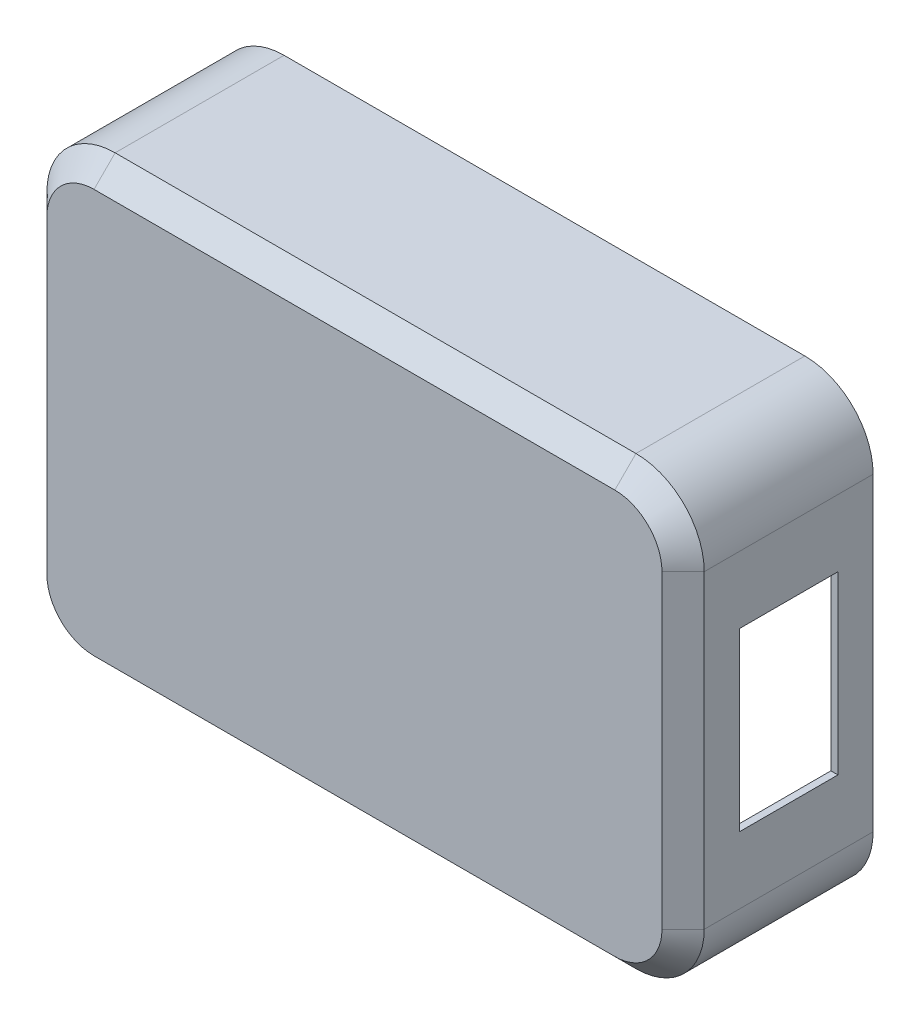
from build123d import *

# Parameters (mm, degrees)
BOSS_EXTRUDE1_DEPTH     = 27
CHAMFER1_SIZE           = 3
SHELL1_T                = -1
CUT_EXTRUDE1_REACH      = 131.009
SKETCH2_W               = 14
SKETCH2_H               = 25
BOSS_EXTRUDE2_DEPTH     = 4
SKETCH7_R               = 1.5
CUT_EXTRUDE2_DEPTH      = 3
MIRROR2_COPY_1_DEPTH    = 4
MIRROR2_COPY_2_SKETCH_R = 1.5
MIRROR2_COPY_2_DEPTH    = 3
CHAMFER2_SIZE           = 2
CHAMFER3_SIZE           = 4


with BuildPart() as part:
    # Sketch1 → Boss-Extrude1 (new body)
    with BuildSketch(Plane.XY):
        with BuildLine():
            Line((54.711561383, -75.098685124), (54.711561383, -31.098685124))
            ThreePointArc((54.711561383, -31.098685124), (51.87049716, -24.239749346), (45.011561383, -21.398685124))
            Line((45.011561383, -21.398685124), (-28.988438617, -21.398685124))
            ThreePointArc((-28.988438617, -21.398685124), (-35.847374395, -24.239749346), (-38.688438617, -31.098685124))
            Line((-38.688438617, -31.098685124), (-38.688438617, -75.098685124))
            ThreePointArc((-38.688438617, -75.098685124), (-35.847374395, -81.957620901), (-28.988438617, -84.798685124))
            Line((-28.988438617, -84.798685124), (45.011561383, -84.798685124))
            ThreePointArc((45.011561383, -84.798685124), (51.87049716, -81.957620901), (54.711561383, -75.098685124))
        make_face()
    extrude(amount=BOSS_EXTRUDE1_DEPTH)

    # Chamfer1
    chamfer1_edges = [part.edges().sort_by_distance(p)[0] for p in [
        (-35.847374395, -24.239749346, 27),
        (-38.688438617, -53.098685124, 27),
        (-35.847374395, -81.957620901, 27),
        (8.011561383, -84.798685124, 27),
        (51.87049716, -81.957620901, 27),
        (54.711561383, -53.098685124, 27),
        (51.87049716, -24.239749346, 27),
        (8.011561383, -21.398685124, 27),
    ]]
    chamfer(chamfer1_edges, length=CHAMFER1_SIZE)

    # Shell1
    shell1_openings = [part.faces().sort_by_distance(p)[0] for p in [
        (8.011561383, -53.098685124, 0),
    ]]
    offset(amount=SHELL1_T, openings=shell1_openings, kind=Kind.INTERSECTION)

    # Sketch2 → Cut-Extrude1 (cut, up to next)
    with BuildSketch(Plane(origin=(54.711561383, 0, 0), x_dir=(0, 0, -1), z_dir=(1, 0, 0)), mode=Mode.PRIVATE) as cut_extrude1_sk1:
        with Locations((-12, -53.098685124)):
            Rectangle(SKETCH2_W, SKETCH2_H)
    cut_extrude1_tool1 = extrude(cut_extrude1_sk1.sketch, amount=-CUT_EXTRUDE1_REACH, mode=Mode.PRIVATE) & part.part
    add(cut_extrude1_tool1.solids().sort_by_distance((54.711561, -53.098685, 12))[0], mode=Mode.SUBTRACT)

    # Sketch3 → Boss-Extrude2 (add)
    with BuildSketch(Plane(origin=(0, 0, 0), x_dir=(-1, 0, 0), z_dir=(0, 0, -1))):
        with BuildLine():
            Line((-54.118192185, -30.956291213), (-48.694716552, -30.956291213))
            Line((-48.694716552, -30.956291213), (-48.694716552, -23.033750656))
            ThreePointArc((-48.694716552, -23.033750656), (-52.633018075, -26.155361191), (-54.118192185, -30.956291213))
        make_face()
    boss_extrude2 = extrude(amount=-BOSS_EXTRUDE2_DEPTH)

    # Sketch7 → Cut-Extrude2 (cut)
    with BuildSketch(Plane(origin=(0, 0, 0), x_dir=(-1, 0, 0), z_dir=(0, 0, -1))):
        with Locations((-50.633416054, -28.397006104)):
            Circle(SKETCH7_R)
    cut_extrude2 = extrude(amount=-CUT_EXTRUDE2_DEPTH, mode=Mode.SUBTRACT)

    # Mirror1: Boss-Extrude2, Cut-Extrude2 across plane
    add(boss_extrude2.mirror(Plane(origin=(0, -53.098685124, 0), x_dir=(0, 0, 1), z_dir=(0, -1, 0))))
    add(cut_extrude2.mirror(Plane(origin=(0, -53.098685124, 0), x_dir=(0, 0, 1), z_dir=(0, -1, 0))), mode=Mode.SUBTRACT)

    # Mirror2: Boss-Extrude2, Cut-Extrude2 across plane
    add(boss_extrude2.mirror(Plane.ZY.offset(-8.011561383)))
    add(cut_extrude2.mirror(Plane.ZY.offset(-8.011561383)), mode=Mode.SUBTRACT)

    # Mirror2 copy 1 sketch → Mirror2 copy 1 (add)
    with BuildSketch(Plane(origin=(16.023122766, -106.197370247, 0), x_dir=(1, 0, 0), z_dir=(0, 0, -1))):
        with BuildLine():
            Line((-54.118192185, -30.956291213), (-48.694716552, -30.956291213))
            Line((-48.694716552, -30.956291213), (-48.694716552, -23.033750656))
            ThreePointArc((-48.694716552, -23.033750656), (-52.633018075, -26.155361191), (-54.118192185, -30.956291213))
        make_face()
    extrude(amount=-MIRROR2_COPY_1_DEPTH)

    # Mirror2 copy 2 sketch → Mirror2 copy 2 (cut)
    with BuildSketch(Plane(origin=(16.023122766, -106.197370247, 0), x_dir=(1, 0, 0), z_dir=(0, 0, -1))):
        with Locations((-50.633416054, -28.397006104)):
            Circle(MIRROR2_COPY_2_SKETCH_R)
    extrude(amount=-MIRROR2_COPY_2_DEPTH, mode=Mode.SUBTRACT)

    # Chamfer2
    chamfer2_edges = [part.edges().sort_by_distance(p)[0] for p in [
        (48.694716552, -30.956291213, 2),
        (48.694716552, -75.241079034, 2),
        (-32.671593786, -75.241079034, 2),
        (-32.671593786, -30.956291213, 2),
    ]]
    chamfer(chamfer2_edges, length=CHAMFER2_SIZE)

    # Chamfer3
    # the kernel refuses this chamfer: 4 mm, written as the material it adds along each edge
    with BuildSketch(Plane(origin=(-28.988438617, -31.098685124, 4), x_dir=(-0.39359677864958253, -0.9192831858772744, 0), z_dir=(0.9192831858772744, -0.39359677864958253, 0))) as chamfer3_piece_1_section:
        Polygon((8.7, -CHAMFER3_SIZE), (8.7 - CHAMFER3_SIZE, 0), (8.7, 0), align=None)
    chamfer3_piece_1 = revolve(axis=Axis((-28.988438617, -31.098685124, 4), (0, 0, -1)), revolution_arc=199.53449135, mode=Mode.PRIVATE)
    chamfer3_piece_1 = split(chamfer3_piece_1, bisect_by=Plane(origin=(-32.671593786, -27.350508509, 5.442527719), z_dir=(-1, 0, 0)), keep=Keep.TOP, mode=Mode.PRIVATE)
    chamfer3_piece_1 = split(chamfer3_piece_1, bisect_by=Plane(origin=(-35.212045354, -30.956291213, 5.442527719), z_dir=(0, 1, 0)), keep=Keep.TOP, mode=Mode.PRIVATE)
    chamfer3_piece_1 = split(chamfer3_piece_1, bisect_by=Plane(origin=(-33.138928218, -29.423625644, 5.442527719), z_dir=(-0.7071067811865476, 0.7071067811865476, 0)), keep=Keep.TOP, mode=Mode.PRIVATE)
    add(chamfer3_piece_1)
    with BuildSketch(Plane(origin=(-28.988438617, -75.098685124, 4), x_dir=(0.6783261272249539, -0.7347609578114475, 0), z_dir=(0.7347609578114475, 0.6783261272249539, 0))) as chamfer3_piece_2_section:
        Polygon((8.7, -CHAMFER3_SIZE), (8.7 - CHAMFER3_SIZE, 0), (8.7, 0), align=None)
    chamfer3_piece_2 = revolve(axis=Axis((-28.988438617, -75.098685124, 4), (0, 0, -1)), revolution_arc=199.53449135, mode=Mode.PRIVATE)
    chamfer3_piece_2 = split(chamfer3_piece_2, bisect_by=Plane(origin=(-35.212045354, -75.241079034, 5.44252772), z_dir=(0, -1, 0)), keep=Keep.TOP, mode=Mode.PRIVATE)
    chamfer3_piece_2 = split(chamfer3_piece_2, bisect_by=Plane(origin=(-32.671593786, -78.846861739, 5.44252772), z_dir=(-1, 0, 0)), keep=Keep.TOP, mode=Mode.PRIVATE)
    chamfer3_piece_2 = split(chamfer3_piece_2, bisect_by=Plane(origin=(-33.138928218, -76.773744603, 5.44252772), z_dir=(-0.7071067811865476, -0.7071067811865476, 0)), keep=Keep.TOP, mode=Mode.PRIVATE)
    add(chamfer3_piece_2)
    with BuildSketch(Plane(origin=(45.011561383, -75.098685124, 4), x_dir=(0.39359677864958265, 0.9192831858772744, 0), z_dir=(-0.9192831858772744, 0.39359677864958265, 0))) as chamfer3_piece_3_section:
        Polygon((8.7, -CHAMFER3_SIZE), (8.7 - CHAMFER3_SIZE, 0), (8.7, 0), align=None)
    chamfer3_piece_3 = revolve(axis=Axis((45.011561383, -75.098685124, 4), (0, 0, -1)), revolution_arc=199.53449135, mode=Mode.PRIVATE)
    chamfer3_piece_3 = split(chamfer3_piece_3, bisect_by=Plane(origin=(48.694716552, -78.846861739, 5.44252772), z_dir=(1, 0, 0)), keep=Keep.TOP, mode=Mode.PRIVATE)
    chamfer3_piece_3 = split(chamfer3_piece_3, bisect_by=Plane(origin=(51.23516812, -75.241079034, 5.44252772), z_dir=(0, -1, 0)), keep=Keep.TOP, mode=Mode.PRIVATE)
    chamfer3_piece_3 = split(chamfer3_piece_3, bisect_by=Plane(origin=(49.162050984, -76.773744603, 5.44252772), z_dir=(0.7071067811865476, -0.7071067811865476, 0)), keep=Keep.TOP, mode=Mode.PRIVATE)
    add(chamfer3_piece_3)
    with BuildSketch(Plane(origin=(45.011561383, -31.098685124, 4), x_dir=(-0.6783261272249526, 0.7347609578114488, 0), z_dir=(-0.7347609578114488, -0.6783261272249526, 0))) as chamfer3_piece_4_section:
        Polygon((8.7, -CHAMFER3_SIZE), (8.7 - CHAMFER3_SIZE, 0), (8.7, 0), align=None)
    chamfer3_piece_4 = revolve(axis=Axis((45.011561383, -31.098685124, 4), (0, 0, -1)), revolution_arc=199.53449135, mode=Mode.PRIVATE)
    chamfer3_piece_4 = split(chamfer3_piece_4, bisect_by=Plane(origin=(51.23516812, -30.956291213, 5.44252772), z_dir=(0, 1, 0)), keep=Keep.TOP, mode=Mode.PRIVATE)
    chamfer3_piece_4 = split(chamfer3_piece_4, bisect_by=Plane(origin=(49.162050984, -29.423625644, 5.44252772), z_dir=(0.7071067811865476, 0.7071067811865476, 0)), keep=Keep.TOP, mode=Mode.PRIVATE)
    chamfer3_piece_4 = split(chamfer3_piece_4, bisect_by=Plane(origin=(48.694716552, -27.350508508, 5.44252772), z_dir=(1, 0, 0)), keep=Keep.TOP, mode=Mode.PRIVATE)
    add(chamfer3_piece_4)


solid = part.part
